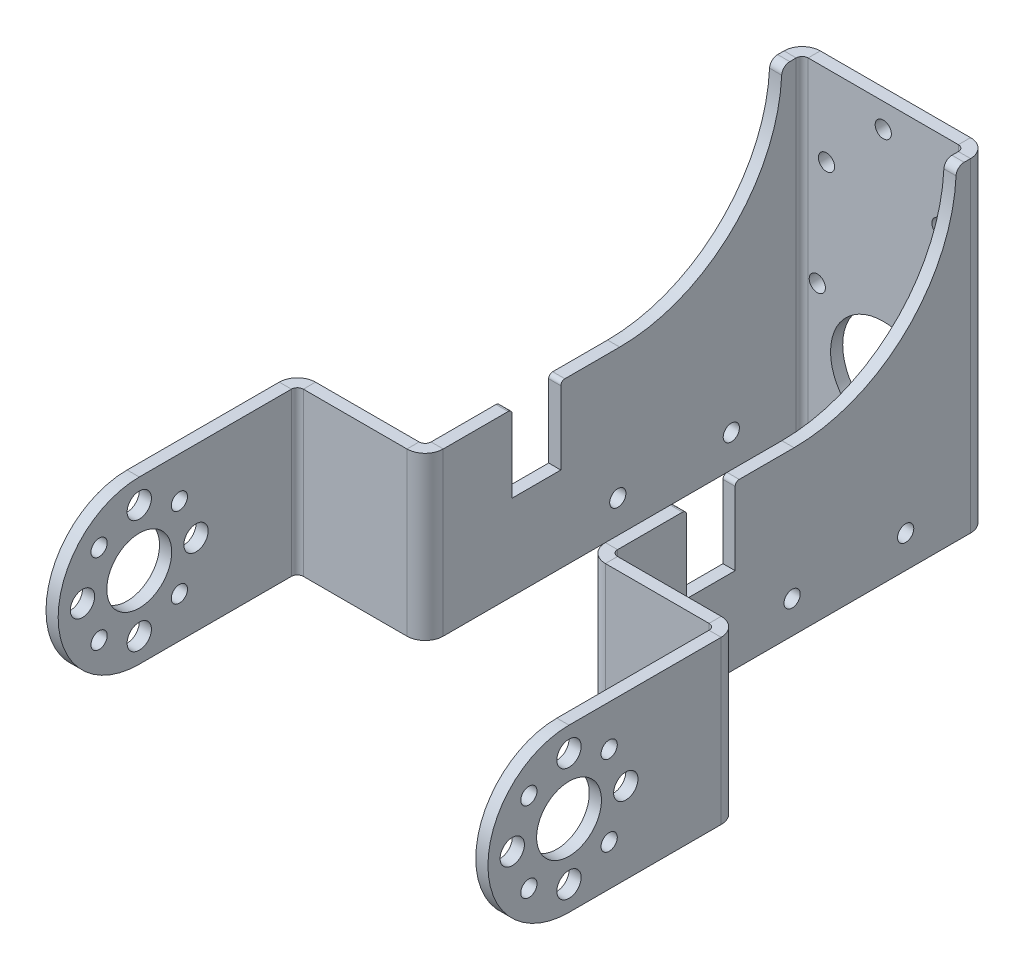
from build123d import *

# Parameters (mm, degrees)
SKETCH_1_W                       = 20
SKETCH_1_H                       = 40
SM_BASE_FLANGE_1_DEPTH           = 1.5
SM_EDGE_FLANGE_1_STRIP_W         = 7.4732
SM_EDGE_FLANGE_1_STRIP_H         = 1.5
SM_EDGE_FLANGE_1_STRIP_CUT_DEPTH = 40
SM_EDGE_FLANGE_1_DEPTH           = 40
SM_EDGE_FLANGE_2_STRIP_W         = 7.4732
SM_EDGE_FLANGE_2_STRIP_H         = 1.5
SM_EDGE_FLANGE_2_STRIP_CUT_DEPTH = 40
SM_EDGE_FLANGE_2_DEPTH           = 40
SM_EDGE_FLANGE_5_STRIP_W         = 7.4732
SM_EDGE_FLANGE_5_STRIP_H         = 1.5
SM_EDGE_FLANGE_5_STRIP_CUT_DEPTH = 40
SM_EDGE_FLANGE_5_DEPTH           = 40
SM_EDGE_FLANGE_6_STRIP_W         = 7.4732
SM_EDGE_FLANGE_6_STRIP_H         = 1.5
SM_EDGE_FLANGE_6_STRIP_CUT_DEPTH = 40
SM_EDGE_FLANGE_6_DEPTH           = 40
SM_EDGE_FLANGE_7_STRIP_W         = 7.4732
SM_EDGE_FLANGE_7_STRIP_H         = 1.5
SM_EDGE_FLANGE_7_STRIP_CUT_DEPTH = 40
SM_EDGE_FLANGE_7_DEPTH           = 40
SM_EDGE_FLANGE_8_STRIP_W         = 7.4732
SM_EDGE_FLANGE_8_STRIP_H         = 1.5
SM_EDGE_FLANGE_8_STRIP_CUT_DEPTH = 40
SM_EDGE_FLANGE_8_DEPTH           = 40
CUT_EXTRUDE_2_DEPTH              = 100
CUT_EXTRUDE_3_DEPTH              = 98.272491001
CUT_EXTRUDE_3_DEPTH_BACK         = 100
SKETCH_33_W                      = 28.7634
SKETCH_33_H                      = 20
CUT_EXTRUDE_START                = 6.752336449
CUT_EXTRUDE_4_DEPTH              = 20
SKETCH_36_W                      = 12.7768
SKETCH_36_H                      = 1.5
CUT_EXTRUDE_7_DEPTH              = 20
CUT_EXTRUDE_START_2              = -20
CUT_EXTRUDE_12_DEPTH             = 20
CUT_EXTRUDE_13_DEPTH             = 20
CUT_EXTRUDE_14_DEPTH             = 20
CUT_EXTRUDE_15_DEPTH             = 20
SKETCH_47_R                      = 1
CUT_EXTRUDE_16_DEPTH             = 2
SKETCH_48_R                      = 6.5
CUT_EXTRUDE_17_DEPTH             = 2
CUT_EXTRUDE_18_DEPTH             = 100
SKETCH_50_R                      = 4
SKETCH_50_R_2                    = 1.5
SKETCH_50_R_3                    = 1
CUT_EXTRUDE_19_DEPTH             = 100
CUT_EXTRUDE_20_DEPTH             = 90.404977521
CUT_EXTRUDE_20_DEPTH_BACK        = 100
SKETCH_51_W                      = 7
SKETCH_51_H                      = 11.5
SKETCH_52_R                      = 1
CUT_EXTRUDE_21_DEPTH             = 100
SKETCH_55_W                      = 7
SKETCH_55_H                      = 2
EXTRUDE_2_DEPTH                  = 1.5
SKETCH_56_W                      = 7
SKETCH_56_H                      = 2
EXTRUDE_3_DEPTH                  = 1.5
EXTRUDE_START                    = -1.5
SKETCH_58_R                      = 1
EXTRUDE_4_DEPTH                  = 1.5
SKETCH_59_R                      = 1
EXTRUDE_5_DEPTH                  = 1.5
SKETCH_60_R                      = 1
EXTRUDE_6_DEPTH                  = 1.5
SKETCH_61_R                      = 1
EXTRUDE_7_DEPTH                  = 1.5
SKETCH_62_R                      = 1
CUT_EXTRUDE_22_DEPTH             = 100
SKETCH_65_W                      = 1.5
SKETCH_65_H                      = 9.5
EXTRUDE_9_DEPTH                  = 1
SKETCH_66_W                      = 1.5
SKETCH_66_H                      = 9.5
EXTRUDE_10_DEPTH                 = 1
FILLET_2_R                       = 1
FILLET_3_R                       = 1
FILLET_4_R                       = 0.5
FILLET_5_R                       = 0.5
FILLET_6_R                       = 0.5
FILLET_7_R                       = 0.5
SKETCH_63_R                      = 1
EXTRUDE_12_DEPTH                 = 1.5
SKETCH_64_R                      = 1
CUT_EXTRUDE_23_DEPTH             = 1.5


# Read off the part's stored shape, not the designer's step: 切除-拉伸4
# Sheet-metal steps are written as plain solids
with BuildPart() as part:
    # Sketch 1 → 基体-法兰1 (new body)
    with BuildSketch(Plane.XY):
        with Locations((1.635514019, 6.752336449)):
            Rectangle(SKETCH_1_W, SKETCH_1_H)
    extrude(amount=-SM_BASE_FLANGE_1_DEPTH)

    # 边线-法兰1 strip (across the edge) → 边线-法兰1 strip cut (cut)
    with BuildSketch(Plane(origin=(11.635514019, -13.247663551, 0), x_dir=(-1, 0, 0), z_dir=(0, 1, 0))):
        with Locations((-3, -0.75)):
            Rectangle(SM_EDGE_FLANGE_1_STRIP_W, SM_EDGE_FLANGE_1_STRIP_H)
    extrude(amount=SM_EDGE_FLANGE_1_STRIP_CUT_DEPTH, mode=Mode.SUBTRACT)

    # 边线-法兰1 section (across the edge) → 边线-法兰1 (add)
    with BuildSketch(Plane(origin=(11.635514019, -13.247663551, 0), x_dir=(-1, 0, 0), z_dir=(0, 1, 0))):
        with BuildLine():
            Line((-1.5, 0.7366), (-1.5, 45))
            Line((-1.5, 45), (0, 45))
            Line((0, 45), (0, 0.7366))
            ThreePointArc((0, 0.7366), (0.215745145, 0.215745145), (0.7366, 0))
            Line((0.7366, 0), (0.7366, -1.5))
            ThreePointArc((0.7366, -1.5), (-0.844915027, -0.844915027), (-1.5, 0.7366))
        make_face()
    extrude(amount=SM_EDGE_FLANGE_1_DEPTH)

    # 边线-法兰2 strip (across the edge) → 边线-法兰2 strip cut (cut)
    with BuildSketch(Plane(origin=(-8.364485981, 26.752336449, 0), x_dir=(1, 0, 0), z_dir=(0, -1, 0))):
        with Locations((-3, -0.75)):
            Rectangle(SM_EDGE_FLANGE_2_STRIP_W, SM_EDGE_FLANGE_2_STRIP_H)
    extrude(amount=SM_EDGE_FLANGE_2_STRIP_CUT_DEPTH, mode=Mode.SUBTRACT)

    # 边线-法兰2 section (across the edge) → 边线-法兰2 (add)
    with BuildSketch(Plane(origin=(-8.364485981, 26.752336449, 0), x_dir=(1, 0, 0), z_dir=(0, -1, 0))):
        with BuildLine():
            Line((-1.5, 0.7366), (-1.5, 45))
            Line((-1.5, 45), (0, 45))
            Line((0, 45), (0, 0.7366))
            ThreePointArc((0, 0.7366), (0.215745145, 0.215745145), (0.7366, 0))
            Line((0.7366, 0), (0.7366, -1.5))
            ThreePointArc((0.7366, -1.5), (-0.844915027, -0.844915027), (-1.5, 0.7366))
        make_face()
    extrude(amount=SM_EDGE_FLANGE_2_DEPTH)

    # 边线-法兰5 strip (across the edge) → 边线-法兰5 strip cut (cut)
    with BuildSketch(Plane(origin=(13.135514019, 26.752336449, 45), x_dir=(0, 0, -1), z_dir=(0, -1, 0))):
        with Locations((-3, -0.75)):
            Rectangle(SM_EDGE_FLANGE_5_STRIP_W, SM_EDGE_FLANGE_5_STRIP_H)
    extrude(amount=SM_EDGE_FLANGE_5_STRIP_CUT_DEPTH, mode=Mode.SUBTRACT)

    # 边线-法兰5 section (across the edge) → 边线-法兰5 (add)
    with BuildSketch(Plane(origin=(13.135514019, 26.752336449, 45), x_dir=(0, 0, -1), z_dir=(0, -1, 0))):
        with BuildLine():
            Line((-1.5, 0.7366), (-1.5, 14.25))
            Line((-1.5, 14.25), (0, 14.25))
            Line((0, 14.25), (0, 0.7366))
            ThreePointArc((0, 0.7366), (0.215745145, 0.215745145), (0.7366, 0))
            Line((0.7366, 0), (0.7366, -1.5))
            ThreePointArc((0.7366, -1.5), (-0.844915027, -0.844915027), (-1.5, 0.7366))
        make_face()
    extrude(amount=SM_EDGE_FLANGE_5_DEPTH)

    # 边线-法兰6 strip (across the edge) → 边线-法兰6 strip cut (cut)
    with BuildSketch(Plane(origin=(27.385514019, -13.247663551, 46.5), x_dir=(-1, 0, 0), z_dir=(0, 1, 0))):
        with Locations((-3, -0.75)):
            Rectangle(SM_EDGE_FLANGE_6_STRIP_W, SM_EDGE_FLANGE_6_STRIP_H)
    extrude(amount=SM_EDGE_FLANGE_6_STRIP_CUT_DEPTH, mode=Mode.SUBTRACT)

    # 边线-法兰6 section (across the edge) → 边线-法兰6 (add)
    with BuildSketch(Plane(origin=(27.385514019, -13.247663551, 46.5), x_dir=(-1, 0, 0), z_dir=(0, 1, 0))):
        with BuildLine():
            Line((-1.5, 0.7366), (-1.5, 29.5))
            Line((-1.5, 29.5), (0, 29.5))
            Line((0, 29.5), (0, 0.7366))
            ThreePointArc((0, 0.7366), (0.215745145, 0.215745145), (0.7366, 0))
            Line((0.7366, 0), (0.7366, -1.5))
            ThreePointArc((0.7366, -1.5), (-0.844915027, -0.844915027), (-1.5, 0.7366))
        make_face()
    extrude(amount=SM_EDGE_FLANGE_6_DEPTH)

    # 边线-法兰7 strip (across the edge) → 边线-法兰7 strip cut (cut)
    with BuildSketch(Plane(origin=(-9.864485981, -13.247663551, 45), x_dir=(0, 0, -1), z_dir=(0, 1, 0))):
        with Locations((-3, -0.75)):
            Rectangle(SM_EDGE_FLANGE_7_STRIP_W, SM_EDGE_FLANGE_7_STRIP_H)
    extrude(amount=SM_EDGE_FLANGE_7_STRIP_CUT_DEPTH, mode=Mode.SUBTRACT)

    # 边线-法兰7 section (across the edge) → 边线-法兰7 (add)
    with BuildSketch(Plane(origin=(-9.864485981, -13.247663551, 45), x_dir=(0, 0, -1), z_dir=(0, 1, 0))):
        with BuildLine():
            Line((-1.5, 0.7366), (-1.5, 14.25))
            Line((-1.5, 14.25), (0, 14.25))
            Line((0, 14.25), (0, 0.7366))
            ThreePointArc((0, 0.7366), (0.215745145, 0.215745145), (0.7366, 0))
            Line((0.7366, 0), (0.7366, -1.5))
            ThreePointArc((0.7366, -1.5), (-0.844915027, -0.844915027), (-1.5, 0.7366))
        make_face()
    extrude(amount=SM_EDGE_FLANGE_7_DEPTH)

    # 边线-法兰8 strip (across the edge) → 边线-法兰8 strip cut (cut)
    with BuildSketch(Plane(origin=(-24.114485981, 26.752336449, 46.5), x_dir=(1, 0, 0), z_dir=(0, -1, 0))):
        with Locations((-3, -0.75)):
            Rectangle(SM_EDGE_FLANGE_8_STRIP_W, SM_EDGE_FLANGE_8_STRIP_H)
    extrude(amount=SM_EDGE_FLANGE_8_STRIP_CUT_DEPTH, mode=Mode.SUBTRACT)

    # 边线-法兰8 section (across the edge) → 边线-法兰8 (add)
    with BuildSketch(Plane(origin=(-24.114485981, 26.752336449, 46.5), x_dir=(1, 0, 0), z_dir=(0, -1, 0))):
        with BuildLine():
            Line((-1.5, 0.7366), (-1.5, 29.5))
            Line((-1.5, 29.5), (0, 29.5))
            Line((0, 29.5), (0, 0.7366))
            ThreePointArc((0, 0.7366), (0.215745145, 0.215745145), (0.7366, 0))
            Line((0.7366, 0), (0.7366, -1.5))
            ThreePointArc((0.7366, -1.5), (-0.844915027, -0.844915027), (-1.5, 0.7366))
        make_face()
    extrude(amount=SM_EDGE_FLANGE_8_DEPTH)

    # 草图32 → 切除-拉伸2 (cut)
    with BuildSketch(Plane.ZY.offset(9.864485981)):
        with BuildLine():
            ThreePointArc((2.5, 26.752336449), (8.357864376, 12.610200825), (22.5, 6.752336449))
            ThreePointArc((22.5, 6.752336449), (36.642135624, 12.610200825), (42.5, 26.752336449))
            Line((42.5, 26.752336449), (2.5, 26.752336449))
        make_face()
        with BuildLine():
            Line((2.5, 26.752336449), (42.5, 26.752336449))
            ThreePointArc((42.5, 26.752336449), (22.5, 46.752336449), (2.5, 26.752336449))
        make_face()
        with BuildLine():
            ThreePointArc((42.5, 26.752336449), (36.642135624, 12.610200825), (22.5, 6.752336449))
            Line((22.5, 6.752336449), (44.2634, 6.752336449))
            Line((44.2634, 6.752336449), (44.2634, 26.752336449))
            Line((44.2634, 26.752336449), (42.5, 26.752336449))
        make_face()
    extrude(amount=-CUT_EXTRUDE_2_DEPTH, mode=Mode.SUBTRACT)

    # 草图33 → 切除-拉伸3 (cut, two sides: drawn at the far end of the back side and taken through both)
    with BuildSketch(Plane.ZY.offset(25.614485981).offset(-CUT_EXTRUDE_3_DEPTH_BACK)):
        with Locations((61.6183, 16.752336449)):
            Rectangle(SKETCH_33_W, SKETCH_33_H)
    extrude(amount=CUT_EXTRUDE_3_DEPTH + CUT_EXTRUDE_3_DEPTH_BACK, mode=Mode.SUBTRACT)

    # 切除-拉伸4 outline → 切除-拉伸4 (cut)
    with BuildSketch(Plane(origin=(0, 0, 0), x_dir=(1, 0, 0), z_dir=(0, 1, 0)).offset(CUT_EXTRUDE_START)):
        with BuildLine():
            ThreePointArc((-24.114485981, -47.2366), (-23.978415857, -46.810051729), (-23.620477218, -46.541093672))
            Line((-23.620477218, -46.541093672), (-24.114485981, -45.124776144))
            ThreePointArc((-24.114485981, -45.124776144), (-25.201324919, -45.941435918), (-25.614485981, -47.2366))
            Line((-25.614485981, -47.2366), (-24.114485981, -47.2366))
        make_face()
    extrude(amount=CUT_EXTRUDE_4_DEPTH, mode=Mode.SUBTRACT)

    # 草图36 → 切除-拉伸7 (cut)
    with BuildSketch(Plane(origin=(0, 26.752336449, 0), x_dir=(1, 0, 0), z_dir=(0, 1, 0))):
        with Locations((-16.989485981, -45.75)):
            Rectangle(SKETCH_36_W, SKETCH_36_H)
    extrude(amount=-CUT_EXTRUDE_7_DEPTH, mode=Mode.SUBTRACT)

    # 草图43 → 切除-拉伸12 (cut)
    with BuildSketch(Plane(origin=(0, 26.752336449, 0), x_dir=(1, 0, 0), z_dir=(0, 1, 0)).offset(CUT_EXTRUDE_START_2)):
        with BuildLine():
            Line((-8.364485981, -44.2634), (-9.864485981, -44.2634))
            ThreePointArc((-9.864485981, -44.2634), (-10.080231126, -44.784254855), (-10.601085981, -45))
            Line((-10.601085981, -45), (-10.601085981, -46.5))
            ThreePointArc((-10.601085981, -46.5), (-9.019570955, -45.844915027), (-8.364485981, -44.2634))
        make_face()
    extrude(amount=CUT_EXTRUDE_12_DEPTH, mode=Mode.SUBTRACT)

    # 草图44 → 切除-拉伸13 (cut)
    with BuildSketch(Plane(origin=(0, 26.752336449, 0), x_dir=(1, 0, 0), z_dir=(0, 1, 0))):
        with BuildLine():
            Line((-23.377885981, -46.5), (-23.377885981, -45))
            ThreePointArc((-23.377885981, -45), (-23.751432714, -45.031414657), (-24.114485981, -45.124776144))
            Line((-24.114485981, -45.124776144), (-23.620477218, -46.541093672))
            ThreePointArc((-23.620477218, -46.541093672), (-23.500909554, -46.510346077), (-23.377885981, -46.5))
        make_face()
    extrude(amount=-CUT_EXTRUDE_13_DEPTH, mode=Mode.SUBTRACT)

    # 草图45 → 切除-拉伸14 (cut)
    with BuildSketch(Plane(origin=(0, 26.752336449, 0), x_dir=(1, 0, 0), z_dir=(0, 1, 0))):
        with BuildLine():
            Line((13.135514019, -44.2634), (11.635514019, -44.2634))
            ThreePointArc((11.635514019, -44.2634), (12.290598992, -45.844915027), (13.872114019, -46.5))
            Line((13.872114019, -46.5), (13.872114019, -45))
            ThreePointArc((13.872114019, -45), (13.590229402, -44.943929664), (13.351259164, -44.784254855))
            ThreePointArc((13.351259164, -44.784254855), (13.191584355, -44.545284616), (13.135514019, -44.2634))
        make_face()
        with BuildLine():
            Line((13.872114019, -45), (13.872114019, -46.5))
            ThreePointArc((13.872114019, -46.5), (15.167278101, -46.086838938), (15.983937875, -45))
            Line((15.983937875, -45), (13.872114019, -45))
        make_face()
        with BuildLine():
            ThreePointArc((15.983937875, -45), (15.167278101, -46.086838938), (13.872114019, -46.5))
            Line((13.872114019, -46.5), (26.648914019, -46.5))
            Line((26.648914019, -46.5), (26.648914019, -46.43860075))
            Line((26.648914019, -46.43860075), (26.648914019, -45))
            Line((26.648914019, -45), (15.983937875, -45))
        make_face()
    extrude(amount=-CUT_EXTRUDE_14_DEPTH, mode=Mode.SUBTRACT)

    # 草图46 → 切除-拉伸15 (cut)
    with BuildSketch(Plane(origin=(0, 26.752336449, 0), x_dir=(1, 0, 0), z_dir=(0, 1, 0)).offset(CUT_EXTRUDE_START_2)):
        with BuildLine():
            Line((26.648914019, -45), (26.648914019, -46.5))
            ThreePointArc((26.648914019, -46.5), (27.169768874, -46.715745145), (27.385514019, -47.2366))
            Line((27.385514019, -47.2366), (28.885514019, -47.2366))
            ThreePointArc((28.885514019, -47.2366), (28.230429045, -45.655084973), (26.648914019, -45))
        make_face()
    extrude(amount=CUT_EXTRUDE_15_DEPTH, mode=Mode.SUBTRACT)

    # 草图47 → 切除-拉伸16 (cut)
    with BuildSketch(Plane(origin=(0, 0, -1.5), x_dir=(-1, 0, 0), z_dir=(0, 0, -1))):
        with Locations((-1.635514019, 23.752336449)):
            Circle(SKETCH_47_R)
        with Locations((-8.635514019, 16.752336449)):
            Circle(SKETCH_47_R)
        with Locations((5.364485981, 16.752336449)):
            Circle(SKETCH_47_R)
        with Locations((-8.635514019, 2.752336449)):
            Circle(SKETCH_47_R)
        with Locations((5.364485981, 2.752336449)):
            Circle(SKETCH_47_R)
    extrude(amount=-CUT_EXTRUDE_16_DEPTH, mode=Mode.SUBTRACT)

    # 草图48 → 切除-拉伸17 (cut)
    with BuildSketch(Plane(origin=(0, 0, -1.5), x_dir=(-1, 0, 0), z_dir=(0, 0, -1))):
        with Locations((-1.635514019, -3.247663551)):
            Circle(SKETCH_48_R)
    extrude(amount=-CUT_EXTRUDE_17_DEPTH, mode=Mode.SUBTRACT)

    # 草图49 → 切除-拉伸18 (cut)
    with BuildSketch(Plane.ZY.offset(25.614485981)):
        with BuildLine():
            ThreePointArc((66, 6.752336449), (73.071067812, 3.82340426), (76, -3.247663551))
            Line((76, -3.247663551), (76, 6.752336449))
            Line((76, 6.752336449), (66, 6.752336449))
        make_face()
        with BuildLine():
            Line((76, -13.247663551), (76, -3.247663551))
            ThreePointArc((76, -3.247663551), (73.071067812, -10.318731363), (66, -13.247663551))
            Line((66, -13.247663551), (76, -13.247663551))
        make_face()
    extrude(amount=-CUT_EXTRUDE_18_DEPTH, mode=Mode.SUBTRACT)

    # 草图50 → 切除-拉伸19 (cut)
    with BuildSketch(Plane.ZY.offset(25.614485981)):
        with Locations((66, -3.247663551)):
            Circle(SKETCH_50_R)
        with Locations((66, 3.752336449)):
            Circle(SKETCH_50_R_2)
        with Locations((70.949747468, 1.702083917)):
            Circle(SKETCH_50_R_3)
        with Locations((73, -3.247663551)):
            Circle(SKETCH_50_R_2)
        with Locations((70.949747468, -8.19741102)):
            Circle(SKETCH_50_R_3)
        with Locations((66, -10.247663551)):
            Circle(SKETCH_50_R_2)
        with Locations((61.050252532, -8.19741102)):
            Circle(SKETCH_50_R_3)
        with Locations((59, -3.247663551)):
            Circle(SKETCH_50_R_2)
        with Locations((61.050252532, 1.702083917)):
            Circle(SKETCH_50_R_3)
    extrude(amount=-CUT_EXTRUDE_19_DEPTH, mode=Mode.SUBTRACT)

    # 草图51 → 切除-拉伸20 (cut, two sides: drawn at the far end of the back side and taken through both)
    with BuildSketch(Plane.ZY.offset(9.864485981).offset(-CUT_EXTRUDE_20_DEPTH_BACK)):
        with Locations((33.2634, 1.002336449)):
            Rectangle(SKETCH_51_W, SKETCH_51_H)
    extrude(amount=CUT_EXTRUDE_20_DEPTH + CUT_EXTRUDE_20_DEPTH_BACK, mode=Mode.SUBTRACT)

    # 草图52 → 切除-拉伸21 (cut)
    with BuildSketch(Plane.ZY.offset(9.864485981)):
        with Locations((3.7366, 11.752336449)):
            Circle(SKETCH_52_R)
        with Locations((3.7366, -8.247663551)):
            Circle(SKETCH_52_R)
    extrude(amount=-CUT_EXTRUDE_21_DEPTH, mode=Mode.SUBTRACT)

    # 草图55 → 凸台-拉伸2 (add)
    with BuildSketch(Plane.ZY.offset(9.864485981)):
        with Locations((33.2634, -3.747663551)):
            Rectangle(SKETCH_55_W, SKETCH_55_H)
    extrude(amount=-EXTRUDE_2_DEPTH)

    # 草图56 → 凸台-拉伸3 (add)
    with BuildSketch(Plane(origin=(13.135514019, 0, 0), x_dir=(0, 0, -1), z_dir=(1, 0, 0))):
        with Locations((-33.2634, -3.747663551)):
            Rectangle(SKETCH_56_W, SKETCH_56_H)
    extrude(amount=-EXTRUDE_3_DEPTH)

    # 草图58 → 凸台-拉伸4 (add)
    with BuildSketch(Plane(origin=(13.135514019, 0, 0), x_dir=(0, 0, -1), z_dir=(1, 0, 0)).offset(EXTRUDE_START)):
        with Locations(Location((-3.7366, 11.752336449, 0), (0, 0, 180))):
            Circle(SKETCH_58_R)
    extrude(amount=EXTRUDE_4_DEPTH)

    # 草图59 → 凸台-拉伸5 (add)
    with BuildSketch(Plane.ZY.offset(9.864485981)):
        with Locations((3.7366, 11.752336449)):
            Circle(SKETCH_59_R)
    extrude(amount=-EXTRUDE_5_DEPTH)

    # 草图60 → 凸台-拉伸6 (add)
    with BuildSketch(Plane.ZY.offset(9.864485981)):
        with Locations((3.7366, -8.247663551)):
            Circle(SKETCH_60_R)
    extrude(amount=-EXTRUDE_6_DEPTH)

    # 草图61 → 凸台-拉伸7 (add)
    with BuildSketch(Plane(origin=(13.135514019, 0, 0), x_dir=(0, 0, -1), z_dir=(1, 0, 0)).offset(EXTRUDE_START)):
        with Locations((-3.7366, -8.247663551)):
            Circle(SKETCH_61_R)
    extrude(amount=EXTRUDE_7_DEPTH)

    # 草图62 → 切除-拉伸22 (cut)
    with BuildSketch(Plane(origin=(13.135514019, 0, 0), x_dir=(0, 0, -1), z_dir=(1, 0, 0))):
        with Locations((-22.7366, -9.247663551)):
            Circle(SKETCH_62_R)
        with Locations((-8.7366, -9.247663551)):
            Circle(SKETCH_62_R)
    extrude(amount=-CUT_EXTRUDE_22_DEPTH, mode=Mode.SUBTRACT)

    # 草图65 → 凸台-拉伸9 (add)
    with BuildSketch(Plane(origin=(0, 0, 36.7634), x_dir=(-1, 0, 0), z_dir=(0, 0, -1))):
        with Locations((-12.385514019, 2.002336449)):
            Rectangle(SKETCH_65_W, SKETCH_65_H)
    extrude(amount=EXTRUDE_9_DEPTH)

    # 草图66 → 凸台-拉伸10 (add)
    with BuildSketch(Plane(origin=(0, 0, 36.7634), x_dir=(-1, 0, 0), z_dir=(0, 0, -1))):
        with Locations((9.114485981, 2.002336449)):
            Rectangle(SKETCH_66_W, SKETCH_66_H)
    extrude(amount=EXTRUDE_10_DEPTH)

    # 圆角2
    fillet_2_edges = [part.edges().sort_by_distance(p)[0] for p in [
        (-9.114485981, 26.752336449, 2.5),
    ]]
    fillet(fillet_2_edges, radius=FILLET_2_R)

    # 圆角3
    fillet_3_edges = [part.edges().sort_by_distance(p)[0] for p in [
        (12.385514019, 26.752336449, 2.5),
    ]]
    fillet(fillet_3_edges, radius=FILLET_3_R)

    # 圆角4
    fillet_4_edges = [part.edges().sort_by_distance(p)[0] for p in [
        (-9.114485981, 6.752336449, 29.7634),
    ]]
    fillet(fillet_4_edges, radius=FILLET_4_R)

    # 圆角5
    fillet_5_edges = [part.edges().sort_by_distance(p)[0] for p in [
        (-9.114485981, 6.752336449, 35.7634),
    ]]
    fillet(fillet_5_edges, radius=FILLET_5_R)

    # 圆角6
    fillet_6_edges = [part.edges().sort_by_distance(p)[0] for p in [
        (12.385514019, 6.752336449, 29.7634),
    ]]
    fillet(fillet_6_edges, radius=FILLET_6_R)

    # 圆角7
    fillet_7_edges = [part.edges().sort_by_distance(p)[0] for p in [
        (12.385514019, 6.752336449, 35.7634),
    ]]
    fillet(fillet_7_edges, radius=FILLET_7_R)

    # 草图63 → 凸台-拉伸12 (add)
    with BuildSketch(Plane(origin=(0, 0, -1.5), x_dir=(-1, 0, 0), z_dir=(0, 0, -1))):
        with Locations((5.364485981, 2.752336449)):
            Circle(SKETCH_63_R)
        with Locations((-8.635514019, 2.752336449)):
            Circle(SKETCH_63_R)
    extrude(amount=-EXTRUDE_12_DEPTH)

    # 草图64 → 切除-拉伸23 (cut)
    with BuildSketch(Plane(origin=(0, 0, -1.5), x_dir=(-1, 0, 0), z_dir=(0, 0, -1))):
        with Locations((6.496185981, 3.252336449)):
            Circle(SKETCH_64_R)
        with Locations((-9.767214019, 3.252336449)):
            Circle(SKETCH_64_R)
    extrude(amount=-CUT_EXTRUDE_23_DEPTH, mode=Mode.SUBTRACT)


solid = part.part
